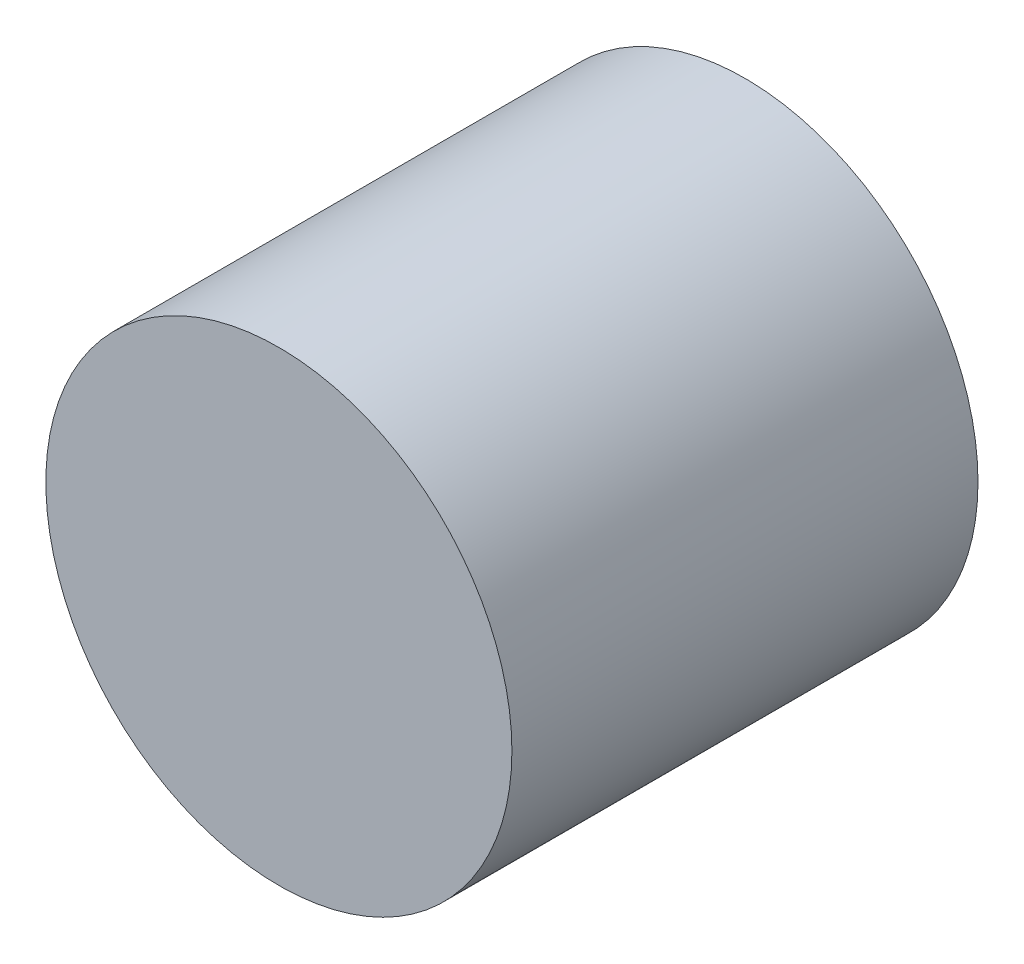
from build123d import *

# Parameters (mm, degrees)
SKETCH1_W = 4
SKETCH1_H = 2


with BuildPart() as part:
    # Sketch1 → Revolve1 (revolve)
    with BuildSketch(Plane(origin=(0, 0, 0), x_dir=(0, 0, -1), z_dir=(1, 0, 0))):
        with Locations((2, 1)):
            Rectangle(SKETCH1_W, SKETCH1_H)
    revolve(axis=Axis((0, 0, 0), (0, 0, -1)))


solid = part.part
